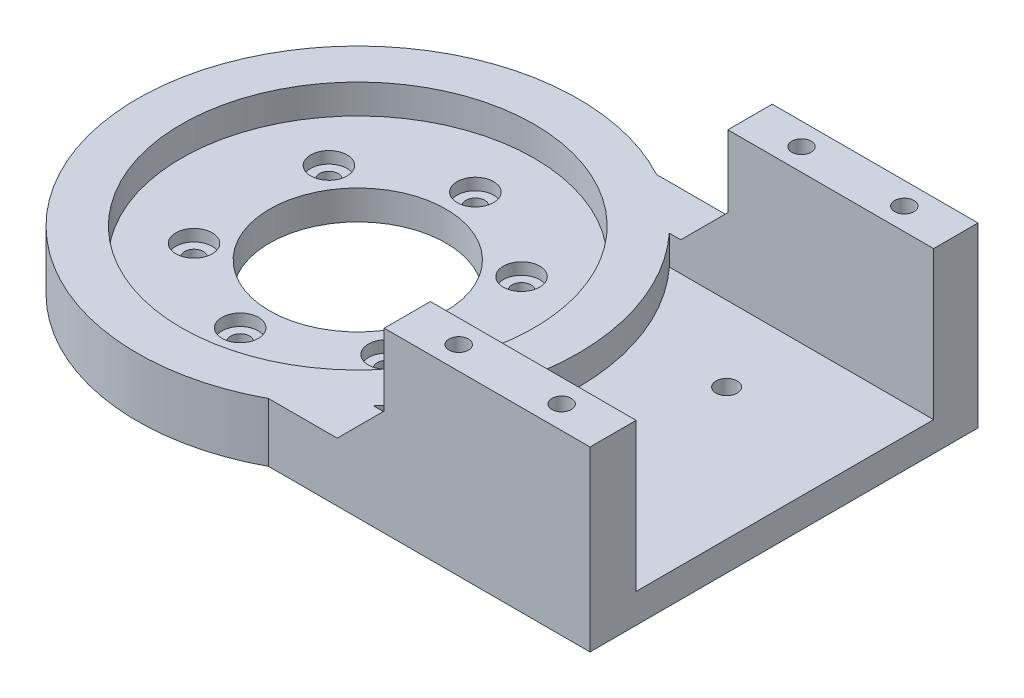
from build123d import *

# Parameters (mm, degrees)
SKETCH1_R                            = 37.5
SKETCH1_R_2                          = 15
BOSS_EXTRUDE2_DEPTH                  = 5
SKETCH3_R                            = 37.5
SKETCH3_R_2                          = 30
BOSS_EXTRUDE3_DEPTH                  = 5
SKETCH4_R                            = 1.6
CUT_EXTRUDE1_DEPTH                   = 5
SKETCH5_R                            = 3.1
CUT_EXTRUDE2_DEPTH                   = 2
BOSS_EXTRUDE4_DEPTH                  = 35
BOSS_EXTRUDE4_DIRECTION_2_REACH      = 86.447
BOSS_EXTRUDE4_DIRECTION_2_END_RADIUS = 37.5
SKETCH9_W                            = 35
SKETCH9_H                            = 7.85
SKETCH9_H_2                          = 7.55
BOSS_EXTRUDE5_DEPTH                  = 20.2
CHAMFER1_SIZE                        = 8
SKETCH11_R                           = 1.65
CUT_EXTRUDE3_DEPTH                   = 88.031833257
SKETCH12_R                           = 3.1
CUT_EXTRUDE4_DEPTH                   = 2.5
SKETCH15_R                           = 1.8
CUT_EXTRUDE5_DEPTH                   = 10


with BuildPart() as part:
    # Sketch1 → Boss-Extrude2 (new body)
    with BuildSketch(Plane(origin=(0, 0, 0), x_dir=(1, 0, 0), z_dir=(0, 1, 0))):
        Circle(SKETCH1_R)
        Circle(SKETCH1_R_2, mode=Mode.SUBTRACT)
    extrude(amount=BOSS_EXTRUDE2_DEPTH)

    # Sketch3 → Boss-Extrude3 (add)
    with BuildSketch(Plane(origin=(0, 5, 0), x_dir=(1, 0, 0), z_dir=(0, 1, 0))):
        Circle(SKETCH3_R)
        Circle(SKETCH3_R_2, mode=Mode.SUBTRACT)
    extrude(amount=BOSS_EXTRUDE3_DEPTH)

    # Sketch4 → Cut-Extrude1 (cut)
    with BuildSketch(Plane(origin=(0, 5, 0), x_dir=(1, 0, 0), z_dir=(0, 1, 0))):
        with Locations((0, 20)):
            Circle(SKETCH4_R)
        with Locations((-16.383040886, 11.471528727)):
            Circle(SKETCH4_R)
        with Locations((16.383040886, 11.471528727)):
            Circle(SKETCH4_R)
        with Locations((16.383040886, -11.471528727)):
            Circle(SKETCH4_R)
        with Locations((0, -20)):
            Circle(SKETCH4_R)
        with Locations((-16.383040886, -11.471528727)):
            Circle(SKETCH4_R)
    extrude(amount=-CUT_EXTRUDE1_DEPTH, mode=Mode.SUBTRACT)

    # Sketch5 → Cut-Extrude2 (cut)
    with BuildSketch(Plane(origin=(0, 5, 0), x_dir=(1, 0, 0), z_dir=(0, 1, 0))):
        with Locations((0, 20)):
            Circle(SKETCH5_R)
        with Locations((-16.383040886, 11.471528727)):
            Circle(SKETCH5_R)
        with Locations((16.383040886, 11.471528727)):
            Circle(SKETCH5_R)
        with Locations((16.383040886, -11.471528727)):
            Circle(SKETCH5_R)
        with Locations((-16.383040886, -11.471528727)):
            Circle(SKETCH5_R)
        with Locations((0, -20)):
            Circle(SKETCH5_R)
    extrude(amount=-CUT_EXTRUDE2_DEPTH, mode=Mode.SUBTRACT)

    # Sketch8 → Boss-Extrude4 (add)
    with BuildSketch(Plane(origin=(37.5, 0, 0), x_dir=(0, 0, -1), z_dir=(1, 0, 0))):
        Polygon((33, 0), (33, 10), (25.45, 10), (25.45, 5), (-25.15, 5), (-25.15, 10), (-33, 10), (-33, 0), align=None)
    extrude(amount=BOSS_EXTRUDE4_DEPTH)

    # Boss-Extrude4 direction 2: up to this cylinder (the profile starts outside it)
    boss_extrude4_direction_2_end = Plane(origin=(0, 3.445946, 0), z_dir=(0, -1, 0)) * Cylinder(BOSS_EXTRUDE4_DIRECTION_2_END_RADIUS, 248.894, mode=Mode.PRIVATE)
    # Sketch8 → Boss-Extrude4 direction 2 (add, up to the surface)
    with BuildSketch(Plane(origin=(37.5, 0, 0), x_dir=(0, 0, -1), z_dir=(1, 0, 0)), mode=Mode.PRIVATE) as boss_extrude4_direction_2_sk1:
        Polygon((33, 0), (33, 10), (25.45, 10), (25.45, 5), (-25.15, 5), (-25.15, 10), (-33, 10), (-33, 0), align=None)
    boss_extrude4_direction_2_tool1 = extrude(boss_extrude4_direction_2_sk1.sketch, amount=-BOSS_EXTRUDE4_DIRECTION_2_REACH, mode=Mode.PRIVATE) - boss_extrude4_direction_2_end
    add(boss_extrude4_direction_2_tool1.solids().sort_by_distance((37.5, 3.445946, 0.093243))[0])
    add(boss_extrude4_direction_2_tool1.solids().sort_by_distance((37.5, 3.445946, 0.093243))[1])

    # Sketch9 → Boss-Extrude5 (add)
    with BuildSketch(Plane(origin=(0, 10, 0), x_dir=(1, 0, 0), z_dir=(0, 1, 0))):
        with Locations((55, -29.075)):
            Rectangle(SKETCH9_W, SKETCH9_H)
        with Locations((55, 29.225)):
            Rectangle(SKETCH9_W, SKETCH9_H_2)
    extrude(amount=BOSS_EXTRUDE5_DEPTH)

    # Chamfer1
    chamfer1_edges = [part.edges().sort_by_distance(p)[0] for p in [
        (37.5, 10, -29.225),
        (37.5, 10, 29.075),
    ]]
    chamfer(chamfer1_edges, length=CHAMFER1_SIZE)

    # Sketch11 → Cut-Extrude3 (cut, through all)
    with BuildSketch(Plane(origin=(0, 30.2, 0), x_dir=(1, 0, 0), z_dir=(0, 1, 0))):
        with Locations((46.25, 29.225)):
            Circle(SKETCH11_R)
        with Locations((63.75, 29.225)):
            Circle(SKETCH11_R)
        with Locations((63.75, -29.075)):
            Circle(SKETCH11_R)
        with Locations((46.25, -29.075)):
            Circle(SKETCH11_R)
    extrude(amount=-CUT_EXTRUDE3_DEPTH, mode=Mode.SUBTRACT)

    # Sketch12 → Cut-Extrude4 (cut)
    with BuildSketch(Plane.XZ):
        with Locations((46.25, 29.075)):
            Circle(SKETCH12_R)
        with Locations((63.75, 29.075)):
            Circle(SKETCH12_R)
        with Locations((63.75, -29.225)):
            Circle(SKETCH12_R)
        with Locations((46.25, -29.225)):
            Circle(SKETCH12_R)
    extrude(amount=-CUT_EXTRUDE4_DEPTH, mode=Mode.SUBTRACT)

    # Sketch15 → Cut-Extrude5 (cut)
    with BuildSketch(Plane(origin=(0, 5, 0), x_dir=(1, 0, 0), z_dir=(0, 1, 0))):
        with Locations((50.089797686, 12.65)):
            Circle(SKETCH15_R)
        with Locations((50.089797686, -12.65)):
            Circle(SKETCH15_R)
    extrude(amount=-CUT_EXTRUDE5_DEPTH, mode=Mode.SUBTRACT)


solid = part.part
